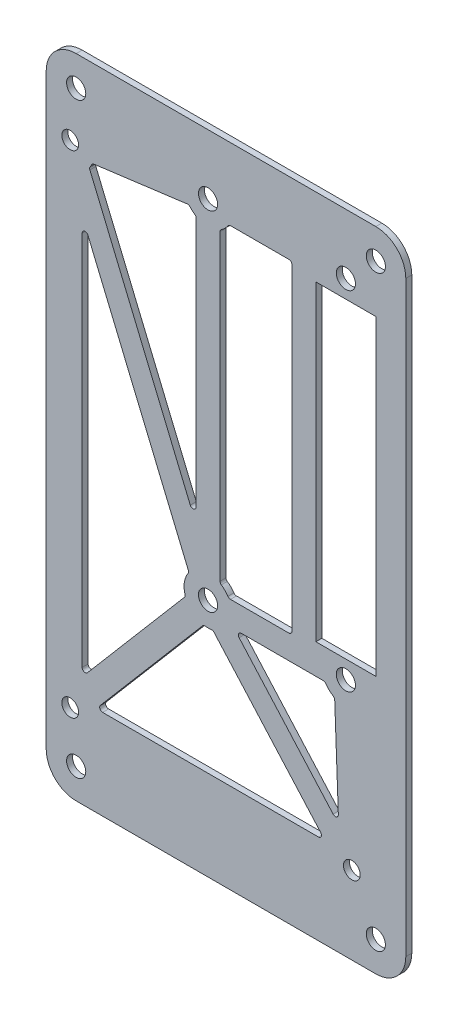
from build123d import *

# Parameters (mm, degrees)
SKETCH_1_W          = 60
SKETCH_1_H          = 108
EXTRUDE_1_DEPTH     = 1
SKETCH_2_R          = 1.6
CUT_EXTRUDE_1_DEPTH = 5
SKETCH_4_R          = 1.6
CUT_EXTRUDE_3_DEPTH = 5
FILLET_1_R          = 5
SKETCH_5_W          = 10
SKETCH_5_H          = 52
CUT_EXTRUDE_4_DEPTH = 62.781874365
SKETCH_6_R          = 1.4
CUT_EXTRUDE_5_DEPTH = 10
CUT_EXTRUDE_6_DEPTH = 10
FILLET_3_R          = 0.5


with BuildPart() as part:
    # ｽｹｯﾁ1 → ﾎﾞｽ - 押し出し1 (new body)
    with BuildSketch(Plane.XY):
        Rectangle(SKETCH_1_W, SKETCH_1_H)
    extrude(amount=EXTRUDE_1_DEPTH)

    # ｽｹｯﾁ2 → ｶｯﾄ - 押し出し1 (cut)
    with BuildSketch(Plane.XY.offset(1)):
        with Locations((-3, 44)):
            Circle(SKETCH_2_R)
        with Locations((20, 44)):
            Circle(SKETCH_2_R)
        with Locations((-3, -14)):
            Circle(SKETCH_2_R)
        with Locations((20, -14)):
            Circle(SKETCH_2_R)
    extrude(amount=-CUT_EXTRUDE_1_DEPTH, mode=Mode.SUBTRACT)

    # ｽｹｯﾁ4 → ｶｯﾄ - 押し出し3 (cut)
    with BuildSketch(Plane.XY.offset(1)):
        with Locations((-25, 49)):
            Circle(SKETCH_4_R)
        with Locations((25, 49)):
            Circle(SKETCH_4_R)
        with Locations((-25, -49)):
            Circle(SKETCH_4_R)
        with Locations((25, -49)):
            Circle(SKETCH_4_R)
    extrude(amount=-CUT_EXTRUDE_3_DEPTH, mode=Mode.SUBTRACT)

    # ﾌｨﾚｯﾄ1
    fillet_1_edges = [part.edges().sort_by_distance(p)[0] for p in [
        (30, -54, 0.5),
        (-30, -54, 0.5),
        (-30, 54, 0.5),
        (30, 54, 0.5),
    ]]
    fillet(fillet_1_edges, radius=FILLET_1_R)

    # ｽｹｯﾁ5 → ｶｯﾄ - 押し出し4 (cut, through all)
    with BuildSketch(Plane(origin=(0, 0, 0), x_dir=(-1, 0, 0), z_dir=(0, 0, -1))):
        with Locations((-20, 15)):
            Rectangle(SKETCH_5_W, SKETCH_5_H)
    extrude(amount=-CUT_EXTRUDE_4_DEPTH, mode=Mode.SUBTRACT)

    # ｽｹｯﾁ6 → ｶｯﾄ - 押し出し5 (cut)
    with BuildSketch(Plane.XY.offset(1)):
        with Locations((21, -41)):
            Circle(SKETCH_6_R)
        with Locations((-26, -41)):
            Circle(SKETCH_6_R)
        with Locations((-26, 41)):
            Circle(SKETCH_6_R)
    extrude(amount=-CUT_EXTRUDE_5_DEPTH, mode=Mode.SUBTRACT)

    # ｽｹｯﾁ7 → ｶｯﾄ - 押し出し6 (cut)
    with BuildSketch(Plane.XY.offset(1)):
        with BuildLine():
            Line((-3.723867235, -17.933956815), (-21.669015133, -39))
            Line((-21.669015133, -39), (16.546312316, -39))
            Line((16.546312316, -39), (-2.19339479, -17.917829506))
            ThreePointArc((-2.19339479, -17.917829506), (-2.957852454, -17.999777942), (-3.723867235, -17.933956815))
        make_face()
        with BuildLine():
            Line((-24, 31.033440501), (-24, -35.567974287))
            Line((-24, -35.567974287), (-6.768840157, -15.340090993))
            ThreePointArc((-6.768840157, -15.340090993), (-6.952204468, -13.383493844), (-6.181631394, -11.575701818))
            Line((-6.181631394, -11.575701818), (-24, 31.033440501))
        make_face()
        with BuildLine():
            Line((1.453687684, -16), (18.795268677, -35.509278617))
            Line((18.795268677, -35.509278617), (18.129582485, -17.535751451))
            ThreePointArc((18.129582485, -17.535751451), (17.224408763, -16.880293958), (16.535898385, -16))
            Line((16.535898385, -16), (1.453687684, -16))
        make_face()
        with BuildLine():
            ThreePointArc((-22.306317046, 39.464843254), (-22.53371525, 39.003786076), (-22.818368606, 38.575701818))
            Line((-22.818368606, 38.575701818), (-5, -4.033440501))
            Line((-5, -4.033440501), (-5, 40.535898385))
            ThreePointArc((-5, 40.535898385), (-5.639182928, 40.994219989), (-6.176326218, 41.568755101))
            Line((-6.176326218, 41.568755101), (-22.306317046, 39.464843254))
        make_face()
        with BuildLine():
            ThreePointArc((-1, -10.535898385), (-0.171572875, -11.171572875), (0.464101615, -12))
            Line((0.464101615, -12), (11, -12))
            Line((11, -12), (11, 42))
            Line((11, 42), (0.464101615, 42))
            ThreePointArc((0.464101615, 42), (-0.171572875, 41.171572875), (-1, 40.535898385))
            Line((-1, 40.535898385), (-1, -10.535898385))
        make_face()
    extrude(amount=-CUT_EXTRUDE_6_DEPTH, mode=Mode.SUBTRACT)

    # ﾌｨﾚｯﾄ3
    fillet_3_edges = [part.edges().sort_by_distance(p)[0] for p in [
        (-1, -10.535898385, 0.5),
        (0.464101615, -12, 0.5),
        (11, -12, 0.5),
        (11, 42, 0.5),
        (-1, 40.535898385, 0.5),
        (0.464101615, 42, 0.5),
        (-5, 40.535898385, 0.5),
        (-6.176326218, 41.568755101, 0.5),
        (-5, -4.033440501, 0.5),
        (-22.818368606, 38.575701818, 0.5),
        (-22.306317046, 39.464843254, 0.5),
        (-24, 31.033440501, 0.5),
        (-6.181631394, -11.575701818, 0.5),
        (-6.768840157, -15.340090993, 0.5),
        (-24, -35.567974287, 0.5),
        (-21.669015133, -39, 0.5),
        (16.546312316, -39, 0.5),
        (-3.723867235, -17.933956815, 0.5),
        (-2.19339479, -17.917829506, 0.5),
        (1.453687684, -16, 0.5),
        (18.795268677, -35.509278617, 0.5),
        (16.535898385, -16, 0.5),
        (18.129582485, -17.535751451, 0.5),
    ]]
    fillet(fillet_3_edges, radius=FILLET_3_R)


solid = part.part
